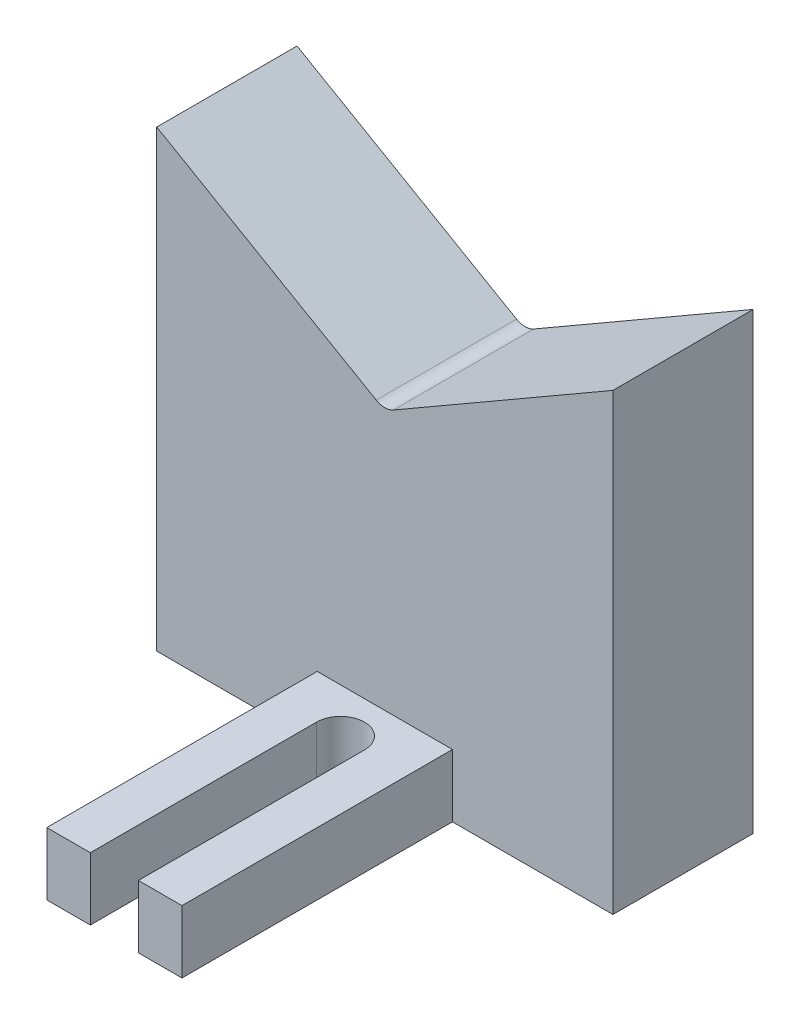
from build123d import *

# Parameters (mm, degrees)
BOSS_EXTRUDE1_DEPTH      = 20.7518
BOSS_EXTRUDE3_DEPTH      = 10
BOSS_EXTRUDE3_DEPTH_BACK = 10
SKETCH6_W                = 40
SKETCH6_H                = 9.27
FILLET1_R                = 2.54
CUT_EXTRUDE11_START      = -47.652475
CUT_EXTRUDE11_DEPTH      = 10


with BuildPart() as part:
    # Sketch1 → Boss-Extrude1 (new body)
    with BuildSketch(Plane.XY):
        Polygon((-33.735, 19.476911331), (0, 0), (33.735, 19.476911331), (33.735, -47.652474646), (-33.735, -47.652474646), align=None)
    extrude(amount=BOSS_EXTRUDE1_DEPTH)

    # Sketch6 → Boss-Extrude3 (add, two sides: drawn at the far end of the back side and taken through both)
    with BuildSketch(Plane(origin=(0, 0, 0), x_dir=(0, 0, -1), z_dir=(1, 0, 0)).offset(-BOSS_EXTRUDE3_DEPTH_BACK)):
        with Locations((-40.7518, -43.017474646)):
            Rectangle(SKETCH6_W, SKETCH6_H)
    extrude(amount=BOSS_EXTRUDE3_DEPTH + BOSS_EXTRUDE3_DEPTH_BACK)

    # Fillet1
    fillet1_edges = [part.edges().sort_by_distance(p)[0] for p in [
        (0, 0, 10.3759),
    ]]
    fillet(fillet1_edges, radius=FILLET1_R)

    # Sketch7 → Cut-Extrude11 (cut)
    with BuildSketch(Plane(origin=(0, 0, 0), x_dir=(1, 0, 0), z_dir=(0, 1, 0)).offset(CUT_EXTRUDE11_START)):
        with BuildLine():
            Line((-3.555, -27.3068), (-3.555, -94.1968))
            ThreePointArc((-3.555, -94.1968), (0, -97.7518), (3.555, -94.1968))
            Line((3.555, -94.1968), (3.555, -27.3068))
            ThreePointArc((3.555, -27.3068), (0, -23.7518), (-3.555, -27.3068))
        make_face()
    extrude(amount=CUT_EXTRUDE11_DEPTH, mode=Mode.SUBTRACT)


solid = part.part
